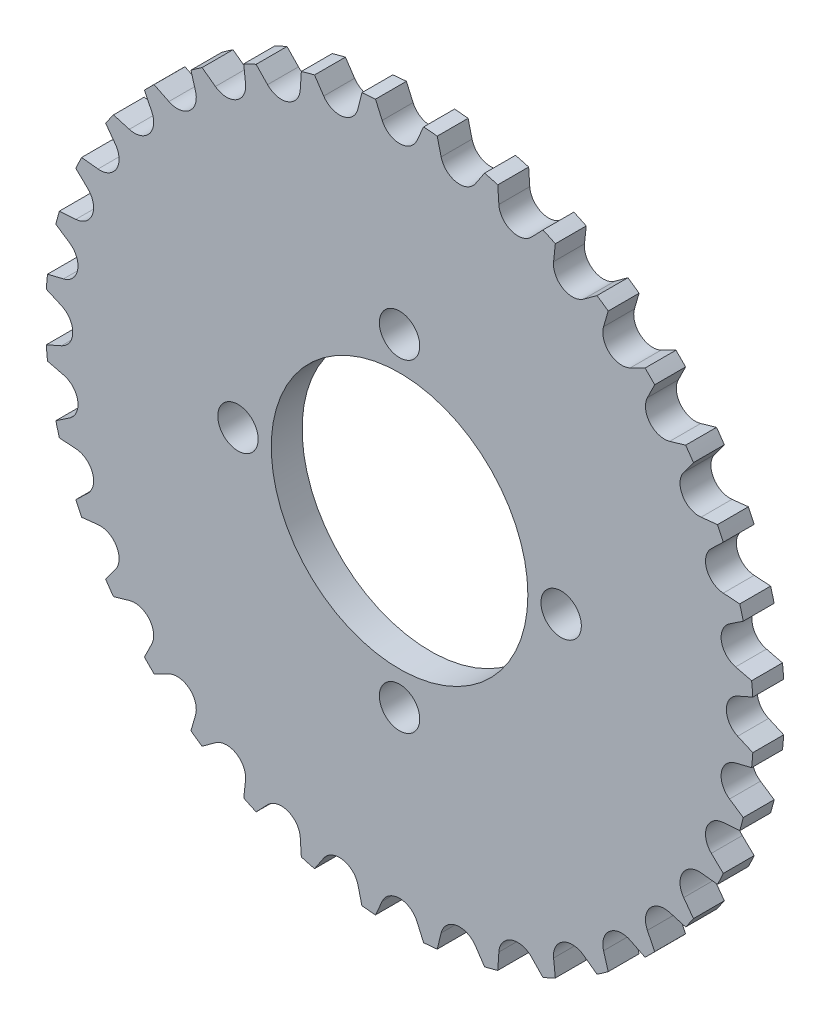
from build123d import *

# Parameters (mm, degrees)
BOSS_EXTRUDE1_DEPTH = 6.5
SKETCH9_R           = 100
SKETCH9_R_2         = 74.5
CUT_EXTRUDE5_DEPTH  = 10
SKETCH10_R          = 27
SKETCH10_R_2        = 4.25
CUT_EXTRUDE6_DEPTH  = 106.316239864


with BuildPart() as part:
    # Sketch1 → Boss-Extrude1 (new body)
    with BuildSketch(Plane.XY):
        with BuildLine():
            ThreePointArc((3.659616426, 71.150315011), (0, 68.765), (-3.659616426, 71.150315011))
            Line((-3.659616426, 71.150315011), (-5.674070045, 75.715990423))
            ThreePointArc((-5.674070045, 75.715990423), (-6.676129894, 76.308513874), (-7.560075586, 75.550986319))
            Line((-7.560075586, 75.550986319), (-8.751103913, 70.704867575))
            ThreePointArc((-8.751103913, 70.704867575), (-11.940916937, 67.720305136), (-15.959141171, 69.433896128))
            Line((-15.959141171, 69.433896128), (-18.735811929, 73.580402472))
            ThreePointArc((-18.735811929, 73.580402472), (-19.825538855, 73.989918294), (-20.564512145, 73.090403726))
            Line((-20.564512145, 73.090403726), (-20.895926387, 68.111088517))
            ThreePointArc((-20.895926387, 68.111088517), (-23.519015156, 64.617963068), (-27.773755488, 65.607763448))
            Line((-27.773755488, 65.607763448), (-31.228275648, 69.209111226))
            ThreePointArc((-31.228275648, 69.209111226), (-32.372558849, 69.423176487), (-32.94410641, 68.409006202))
            Line((-32.94410641, 68.409006202), (-32.405836712, 63.4477885))
            ThreePointArc((-32.405836712, 63.4477885), (-34.3825, 59.552236891), (-38.744478298, 59.788172074))
            Line((-38.744478298, 59.788172074), (-42.771884014, 62.734936156))
            ThreePointArc((-42.771884014, 62.734936156), (-43.935955024, 62.747046593), (-44.322710671, 61.64903564))
            Line((-44.322710671, 61.64903564), (-42.931112087, 56.856659535))
            ThreePointArc((-42.931112087, 56.856659535), (-44.20128998, 52.677046131), (-48.537969741, 52.151947345))
            Line((-48.537969741, 52.151947345), (-53.015890327, 54.354591797))
            ThreePointArc((-53.015890327, 54.354591797), (-54.164379439, 54.164379439), (-54.354591797, 53.015890327))
            Line((-54.354591797, 53.015890327), (-52.151947345, 48.537969741))
            ThreePointArc((-52.151947345, 48.537969741), (-52.677046131, 44.20128998), (-56.856659535, 42.931112087))
            Line((-56.856659535, 42.931112087), (-61.64903564, 44.322710671))
            ThreePointArc((-61.64903564, 44.322710671), (-62.747046593, 43.935955024), (-62.734936156, 42.771884014))
            Line((-62.734936156, 42.771884014), (-59.788172074, 38.744478298))
            ThreePointArc((-59.788172074, 38.744478298), (-59.552236891, 34.3825), (-63.4477885, 32.405836712))
            Line((-63.4477885, 32.405836712), (-68.409006202, 32.94410641))
            ThreePointArc((-68.409006202, 32.94410641), (-69.423176487, 32.372558849), (-69.209111226, 31.228275648))
            Line((-69.209111226, 31.228275648), (-65.607763448, 27.773755488))
            ThreePointArc((-65.607763448, 27.773755488), (-64.617963068, 23.519015156), (-68.111088517, 20.895926387))
            Line((-68.111088517, 20.895926387), (-73.090403726, 20.564512145))
            ThreePointArc((-73.090403726, 20.564512145), (-73.989918294, 19.825538855), (-73.580402472, 18.735811929))
            Line((-73.580402472, 18.735811929), (-69.433896128, 15.959141171))
            ThreePointArc((-69.433896128, 15.959141171), (-67.720305136, 11.940916937), (-70.704867575, 8.751103913))
            Line((-70.704867575, 8.751103913), (-75.550986319, 7.560075586))
            ThreePointArc((-75.550986319, 7.560075586), (-76.308513874, 6.676129894), (-75.715990423, 5.674070045))
            Line((-75.715990423, 5.674070045), (-71.150315011, 3.659616426))
            ThreePointArc((-71.150315011, 3.659616426), (-68.765, 0), (-71.150315011, -3.659616426))
            Line((-71.150315011, -3.659616426), (-75.715990423, -5.674070045))
            ThreePointArc((-75.715990423, -5.674070045), (-76.308513874, -6.676129894), (-75.550986319, -7.560075586))
            Line((-75.550986319, -7.560075586), (-70.704867575, -8.751103913))
            ThreePointArc((-70.704867575, -8.751103913), (-67.720305136, -11.940916937), (-69.433896128, -15.959141171))
            Line((-69.433896128, -15.959141171), (-73.580402472, -18.735811929))
            ThreePointArc((-73.580402472, -18.735811929), (-73.989918294, -19.825538855), (-73.090403726, -20.564512145))
            Line((-73.090403726, -20.564512145), (-68.111088517, -20.895926387))
            ThreePointArc((-68.111088517, -20.895926387), (-64.617963068, -23.519015156), (-65.607763448, -27.773755488))
            Line((-65.607763448, -27.773755488), (-69.209111226, -31.228275648))
            ThreePointArc((-69.209111226, -31.228275648), (-69.423176487, -32.372558849), (-68.409006202, -32.94410641))
            Line((-68.409006202, -32.94410641), (-63.4477885, -32.405836712))
            ThreePointArc((-63.4477885, -32.405836712), (-59.552236891, -34.3825), (-59.788172074, -38.744478298))
            Line((-59.788172074, -38.744478298), (-62.734936156, -42.771884014))
            ThreePointArc((-62.734936156, -42.771884014), (-62.747046593, -43.935955024), (-61.64903564, -44.322710671))
            Line((-61.64903564, -44.322710671), (-56.856659535, -42.931112087))
            ThreePointArc((-56.856659535, -42.931112087), (-52.677046131, -44.20128998), (-52.151947345, -48.537969741))
            Line((-52.151947345, -48.537969741), (-54.354591797, -53.015890327))
            ThreePointArc((-54.354591797, -53.015890327), (-54.164379439, -54.164379439), (-53.015890327, -54.354591797))
            Line((-53.015890327, -54.354591797), (-48.537969741, -52.151947345))
            ThreePointArc((-48.537969741, -52.151947345), (-44.20128998, -52.677046131), (-42.931112087, -56.856659535))
            Line((-42.931112087, -56.856659535), (-44.322710671, -61.64903564))
            ThreePointArc((-44.322710671, -61.64903564), (-43.935955024, -62.747046593), (-42.771884014, -62.734936156))
            Line((-42.771884014, -62.734936156), (-38.744478298, -59.788172074))
            ThreePointArc((-38.744478298, -59.788172074), (-34.3825, -59.552236891), (-32.405836712, -63.4477885))
            Line((-32.405836712, -63.4477885), (-32.94410641, -68.409006202))
            ThreePointArc((-32.94410641, -68.409006202), (-32.372558849, -69.423176487), (-31.228275648, -69.209111226))
            Line((-31.228275648, -69.209111226), (-27.773755488, -65.607763448))
            ThreePointArc((-27.773755488, -65.607763448), (-23.519015156, -64.617963068), (-20.895926387, -68.111088517))
            Line((-20.895926387, -68.111088517), (-20.564512145, -73.090403726))
            ThreePointArc((-20.564512145, -73.090403726), (-19.825538855, -73.989918294), (-18.735811929, -73.580402472))
            Line((-18.735811929, -73.580402472), (-15.959141171, -69.433896128))
            ThreePointArc((-15.959141171, -69.433896128), (-11.940916937, -67.720305136), (-8.751103913, -70.704867575))
            Line((-8.751103913, -70.704867575), (-7.560075586, -75.550986319))
            ThreePointArc((-7.560075586, -75.550986319), (-6.676129894, -76.308513874), (-5.674070045, -75.715990423))
            Line((-5.674070045, -75.715990423), (-3.659616426, -71.150315011))
            ThreePointArc((-3.659616426, -71.150315011), (0, -68.765), (3.659616426, -71.150315011))
            Line((3.659616426, -71.150315011), (5.674070045, -75.715990423))
            ThreePointArc((5.674070045, -75.715990423), (6.676129894, -76.308513874), (7.560075586, -75.550986319))
            Line((7.560075586, -75.550986319), (8.751103913, -70.704867575))
            ThreePointArc((8.751103913, -70.704867575), (11.940916937, -67.720305136), (15.959141171, -69.433896128))
            Line((15.959141171, -69.433896128), (18.735811929, -73.580402472))
            ThreePointArc((18.735811929, -73.580402472), (19.825538855, -73.989918294), (20.564512145, -73.090403726))
            Line((20.564512145, -73.090403726), (20.895926387, -68.111088517))
            ThreePointArc((20.895926387, -68.111088517), (23.519015156, -64.617963068), (27.773755488, -65.607763448))
            Line((27.773755488, -65.607763448), (31.228275648, -69.209111226))
            ThreePointArc((31.228275648, -69.209111226), (32.372558849, -69.423176487), (32.94410641, -68.409006202))
            Line((32.94410641, -68.409006202), (32.405836712, -63.4477885))
            ThreePointArc((32.405836712, -63.4477885), (34.3825, -59.552236891), (38.744478298, -59.788172074))
            Line((38.744478298, -59.788172074), (42.771884014, -62.734936156))
            ThreePointArc((42.771884014, -62.734936156), (43.935955024, -62.747046593), (44.322710671, -61.64903564))
            Line((44.322710671, -61.64903564), (42.931112087, -56.856659535))
            ThreePointArc((42.931112087, -56.856659535), (44.20128998, -52.677046131), (48.537969741, -52.151947345))
            Line((48.537969741, -52.151947345), (53.015890327, -54.354591797))
            ThreePointArc((53.015890327, -54.354591797), (54.164379439, -54.164379439), (54.354591797, -53.015890327))
            Line((54.354591797, -53.015890327), (52.151947345, -48.537969741))
            ThreePointArc((52.151947345, -48.537969741), (52.677046131, -44.20128998), (56.856659535, -42.931112087))
            Line((56.856659535, -42.931112087), (61.64903564, -44.322710671))
            ThreePointArc((61.64903564, -44.322710671), (62.747046593, -43.935955024), (62.734936156, -42.771884014))
            Line((62.734936156, -42.771884014), (59.788172074, -38.744478298))
            ThreePointArc((59.788172074, -38.744478298), (59.552236891, -34.3825), (63.4477885, -32.405836712))
            Line((63.4477885, -32.405836712), (68.409006202, -32.94410641))
            ThreePointArc((68.409006202, -32.94410641), (69.423176487, -32.372558849), (69.209111226, -31.228275648))
            Line((69.209111226, -31.228275648), (65.607763448, -27.773755488))
            ThreePointArc((65.607763448, -27.773755488), (64.617963068, -23.519015156), (68.111088517, -20.895926387))
            Line((68.111088517, -20.895926387), (73.090403726, -20.564512145))
            ThreePointArc((73.090403726, -20.564512145), (73.989918294, -19.825538855), (73.580402472, -18.735811929))
            Line((73.580402472, -18.735811929), (69.433896128, -15.959141171))
            ThreePointArc((69.433896128, -15.959141171), (67.720305136, -11.940916937), (70.704867575, -8.751103913))
            Line((70.704867575, -8.751103913), (75.550986319, -7.560075586))
            ThreePointArc((75.550986319, -7.560075586), (76.308513874, -6.676129894), (75.715990423, -5.674070045))
            Line((75.715990423, -5.674070045), (71.150315011, -3.659616426))
            ThreePointArc((71.150315011, -3.659616426), (68.765, 0), (71.150315011, 3.659616426))
            Line((71.150315011, 3.659616426), (75.715990423, 5.674070045))
            ThreePointArc((75.715990423, 5.674070045), (76.308513874, 6.676129894), (75.550986319, 7.560075586))
            Line((75.550986319, 7.560075586), (70.704867575, 8.751103913))
            ThreePointArc((70.704867575, 8.751103913), (67.720305136, 11.940916937), (69.433896128, 15.959141171))
            Line((69.433896128, 15.959141171), (73.580402472, 18.735811929))
            ThreePointArc((73.580402472, 18.735811929), (73.989918294, 19.825538855), (73.090403726, 20.564512145))
            Line((73.090403726, 20.564512145), (68.111088517, 20.895926387))
            ThreePointArc((68.111088517, 20.895926387), (64.617963068, 23.519015156), (65.607763448, 27.773755488))
            Line((65.607763448, 27.773755488), (69.209111226, 31.228275648))
            ThreePointArc((69.209111226, 31.228275648), (69.423176487, 32.372558849), (68.409006202, 32.94410641))
            Line((68.409006202, 32.94410641), (63.4477885, 32.405836712))
            ThreePointArc((63.4477885, 32.405836712), (59.552236891, 34.3825), (59.788172074, 38.744478298))
            Line((59.788172074, 38.744478298), (62.734936156, 42.771884014))
            ThreePointArc((62.734936156, 42.771884014), (62.747046593, 43.935955024), (61.64903564, 44.322710671))
            Line((61.64903564, 44.322710671), (56.856659535, 42.931112087))
            ThreePointArc((56.856659535, 42.931112087), (52.677046131, 44.20128998), (52.151947345, 48.537969741))
            Line((52.151947345, 48.537969741), (54.354591797, 53.015890327))
            ThreePointArc((54.354591797, 53.015890327), (54.164379439, 54.164379439), (53.015890327, 54.354591797))
            Line((53.015890327, 54.354591797), (48.537969741, 52.151947345))
            ThreePointArc((48.537969741, 52.151947345), (44.20128998, 52.677046131), (42.931112087, 56.856659535))
            Line((42.931112087, 56.856659535), (44.322710671, 61.64903564))
            ThreePointArc((44.322710671, 61.64903564), (43.935955024, 62.747046593), (42.771884014, 62.734936156))
            Line((42.771884014, 62.734936156), (38.744478298, 59.788172074))
            ThreePointArc((38.744478298, 59.788172074), (34.3825, 59.552236891), (32.405836712, 63.4477885))
            Line((32.405836712, 63.4477885), (32.94410641, 68.409006202))
            ThreePointArc((32.94410641, 68.409006202), (32.372558849, 69.423176487), (31.228275648, 69.209111226))
            Line((31.228275648, 69.209111226), (27.773755488, 65.607763448))
            ThreePointArc((27.773755488, 65.607763448), (23.519015156, 64.617963068), (20.895926387, 68.111088517))
            Line((20.895926387, 68.111088517), (20.564512145, 73.090403726))
            ThreePointArc((20.564512145, 73.090403726), (19.825538855, 73.989918294), (18.735811929, 73.580402472))
            Line((18.735811929, 73.580402472), (15.959141171, 69.433896128))
            ThreePointArc((15.959141171, 69.433896128), (11.940916937, 67.720305136), (8.751103913, 70.704867575))
            Line((8.751103913, 70.704867575), (7.560075586, 75.550986319))
            ThreePointArc((7.560075586, 75.550986319), (6.676129894, 76.308513874), (5.674070045, 75.715990423))
            Line((5.674070045, 75.715990423), (3.659616426, 71.150315011))
        make_face()
    extrude(amount=BOSS_EXTRUDE1_DEPTH)

    # Sketch9 → Cut-Extrude5 (cut)
    with BuildSketch(Plane(origin=(0, 0, 0), x_dir=(-1, 0, 0), z_dir=(0, 0, -1))):
        Circle(SKETCH9_R)
        Circle(SKETCH9_R_2, mode=Mode.SUBTRACT)
    extrude(amount=-CUT_EXTRUDE5_DEPTH, mode=Mode.SUBTRACT)

    # Sketch10 → Cut-Extrude6 (cut, through all)
    with BuildSketch(Plane.XY.offset(6.5)):
        Circle(SKETCH10_R)
        with Locations((0, 34)):
            Circle(SKETCH10_R_2)
        with Locations((34, 0)):
            Circle(SKETCH10_R_2)
        with Locations((0, -34)):
            Circle(SKETCH10_R_2)
        with Locations((-34, 0)):
            Circle(SKETCH10_R_2)
    extrude(amount=-CUT_EXTRUDE6_DEPTH, mode=Mode.SUBTRACT)


solid = part.part
